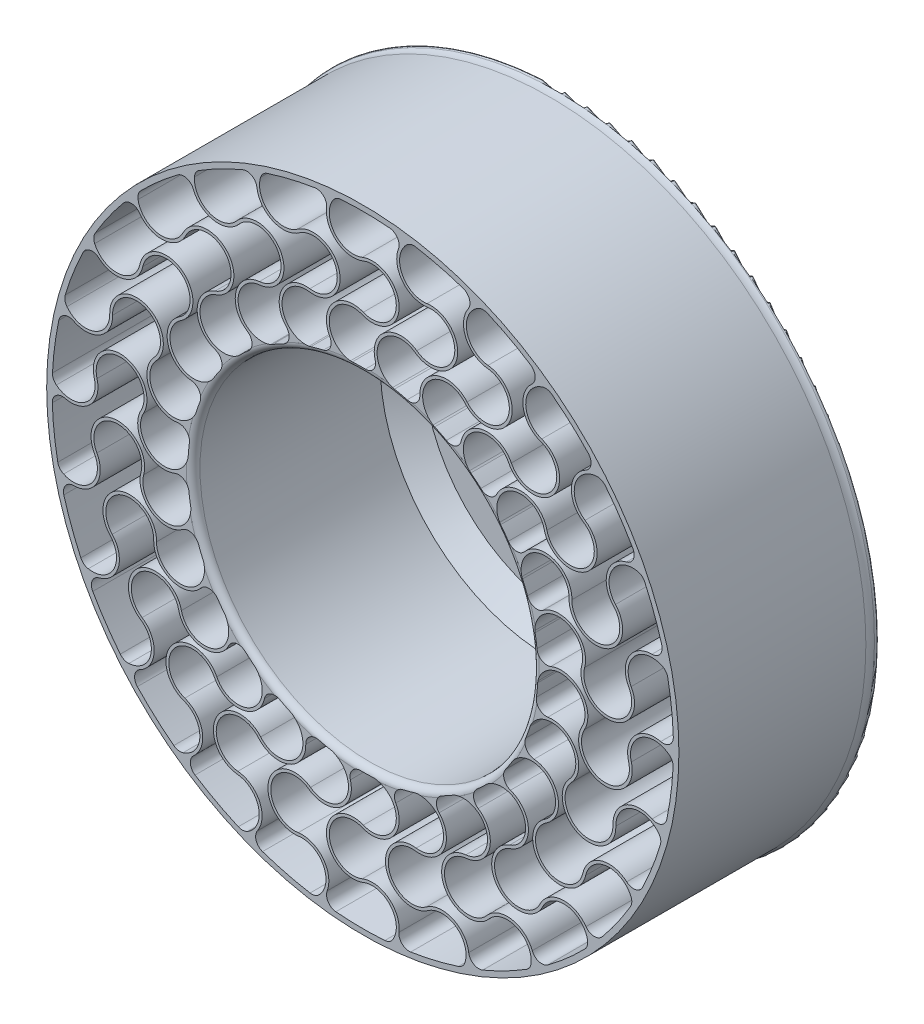
from build123d import *

# Parameters (mm, degrees)
SKETCH1_R                      = 25.75
SKETCH1_R_2                    = 24.95
BOSS_EXTRUDE1_DEPTH            = 27.5
SUPPORTELEMENT_DEPTH           = 27.5
SKETCH3_R                      = 46.5
SKETCH3_R_2                    = 45.7
WHEELRIM_DEPTH                 = 27.5
SUPPORTFILLET_R                = 1.5
CIRPATTERN1_COUNT              = 26
SUPPORTFILLET_OF_CIRPATTERN1_R = 1.5
SKETCH6_R                      = 3.35
BOSS_EXTRUDE2_DEPTH            = 3
SKETCH7_R                      = 1.45
CUT_EXTRUDE1_DEPTH             = 72.773447838


with BuildPart() as part:
    # Sketch1 → Boss-Extrude1 (new body)
    with BuildSketch(Plane.XY):
        Circle(SKETCH1_R)
        Circle(SKETCH1_R_2, mode=Mode.SUBTRACT)
    extrude(amount=BOSS_EXTRUDE1_DEPTH)

    # Sketch2 → SupportElement (add, through all)
    with BuildSketch(Plane.XY.offset(27.5)):
        with BuildLine():
            ThreePointArc((-3.528823527, 46.365907783), (-2.931248774, 46.407518579), (-2.333187577, 46.441428011))
            ThreePointArc((-2.333187577, 46.441428011), (-4.744952593, 41.912596767), (-0.0791435, 39.777848902))
            ThreePointArc((-0.0791435, 39.777848902), (5.350743301, 36.125), (-0.0791435, 32.472151098))
            ThreePointArc((-0.0791435, 32.472151098), (-4.836479603, 30.017910974), (-1.678989563, 25.695203717))
            ThreePointArc((-1.678989563, 25.695203717), (-2.316518866, 25.645589101), (-2.952619591, 25.58015906))
            ThreePointArc((-2.952619591, 25.58015906), (-5.047741148, 30.724265083), (0.0791435, 32.861182235))
            ThreePointArc((0.0791435, 32.861182235), (4.930743301, 36.125), (0.0791435, 39.388817765))
            ThreePointArc((0.0791435, 39.388817765), (-4.910093331, 41.23021634), (-3.528823527, 46.365907783))
        make_face()
    supportelement = extrude(amount=-SUPPORTELEMENT_DEPTH)

    # Sketch3 → WheelRim (add, through all)
    with BuildSketch(Plane.XY.offset(27.5)):
        with Locations(Location((0, 0, 0), (0, 0, 180))):
            Circle(SKETCH3_R)
        Circle(SKETCH3_R_2, mode=Mode.SUBTRACT)
    extrude(amount=-WHEELRIM_DEPTH)

    # SupportFillet
    supportfillet_edges = [part.edges().sort_by_distance(p)[0] for p in [
        (-1.678989563, 25.695203717, 13.75),
        (-2.952619591, 25.58015906, 13.75),
        (-3.898537289, 45.533409789, 13.75),
        (-4.50893023, 45.4770222, 13.75),
    ]]
    fillet(supportfillet_edges, radius=SUPPORTFILLET_R)

    # CirPattern1: SupportElement ×26 about axis
    cirpattern1_axis = Axis((0, 0, 0), (0, 0, 1))
    for i in range(1, CIRPATTERN1_COUNT):
        add(supportelement.rotate(cirpattern1_axis, i * 360 / CIRPATTERN1_COUNT))

    # SupportFillet of CirPattern1
    supportfillet_of_cirpattern1_edges = [part.edges().sort_by_distance(p)[0] for p in [
        (-7.779465924, 24.546739293, 13.75),
        (-8.98855459, 24.130238009, 13.75),
        (-14.682111091, 43.277310613, 13.75),
        (-15.261272689, 43.076484953, 13.75),
        (-13.427828003, 21.971707606, 13.75),
        (-14.502107468, 21.277955235, 13.75),
        (-24.612413965, 38.506091451, 13.75),
        (-25.126685453, 38.172498977, 13.75),
        (-18.295813527, 18.119760136, 13.75),
        (-19.172850573, 17.189075045, 13.75),
        (-33.112332801, 31.497038218, 13.75),
        (-33.53182659, 31.050066112, 13.75),
        (-22.100512871, 13.21475807, 13.75),
        (-22.729337294, 12.101228293, 13.75),
        (-39.687883213, 22.65749161, 13.75),
        (-39.988219848, 22.123116267, 13.75),
        (-24.620810739, 7.541762299, 13.75),
        (-24.964877548, 6.310102138, 13.75),
        (-43.956918112, 12.501173947, 13.75),
        (-44.120643121, 11.910451319, 13.75),
        (-25.71023658, 1.430466716, 13.75),
        (-25.749549864, 0.152255784, 13.75),
        (-45.671336708, 1.618333494, 13.75),
        (-45.688934987, 1.005594232, 13.75),
        (-25.305476923, -4.763962393, 13.75),
        (-25.037751937, -6.014439123, 13.75),
        (-44.731503223, -9.358558619, 13.75),
        (-44.601952024, -9.957704335, 13.75),
        (-23.43005493, -10.681527324, 13.75),
        (-22.870850875, -11.83159669, 13.75),
        (-41.192037363, -19.791565322, 13.75),
        (-40.922865731, -20.342297322, 13.75),
        (-20.192963309, -15.978320713, 13.75),
        (-19.374779094, -16.961144863, 13.75),
        (-35.258640018, -29.074358189, 13.75),
        (-34.865491231, -29.54466993, 13.75),
        (-15.782330059, -20.346512181, 13.75),
        (-14.752715575, -21.104972948, 13.75),
        (-27.276138675, -36.667455038, 13.75),
        (-26.781861111, -37.030013711, 13.75),
        (-10.454485152, -23.532238317, 13.75),
        (-9.273277852, -24.022256719, 13.75),
        (-17.708447298, -42.129572681, 13.75),
        (-17.141766571, -42.363307695, 13.75),
        (-4.519063569, -25.350356299, 13.75),
        (-3.254910927, -25.543454247, 13.75),
        (-7.111605331, -45.143272695, 13.75),
        (-6.505454866, -45.234600219, 13.75),
        (1.678989563, -25.695203717, 13.75),
        (2.952619591, -25.58015906, 13.75),
        (3.898537289, -45.533409789, 13.75),
        (4.50893023, -45.4770222, 13.75),
        (7.779465924, -24.546739293, 13.75),
        (8.98855459, -24.130238009, 13.75),
        (14.682111091, -43.277310613, 13.75),
        (15.261272689, -43.076484953, 13.75),
        (13.427828003, -21.971707606, 13.75),
        (14.502107468, -21.277955235, 13.75),
        (24.612413965, -38.506091451, 13.75),
        (25.126685453, -38.172498977, 13.75),
        (18.295813527, -18.119760136, 13.75),
        (19.172850573, -17.189075045, 13.75),
        (33.112332801, -31.497038218, 13.75),
        (33.53182659, -31.050066112, 13.75),
        (22.100512871, -13.21475807, 13.75),
        (22.729337294, -12.101228293, 13.75),
        (39.687883213, -22.65749161, 13.75),
        (39.988219848, -22.123116267, 13.75),
        (24.620810739, -7.541762299, 13.75),
        (24.964877548, -6.310102138, 13.75),
        (43.956918112, -12.501173947, 13.75),
        (44.120643121, -11.910451319, 13.75),
        (25.71023658, -1.430466716, 13.75),
        (25.749549864, -0.152255784, 13.75),
        (45.671336708, -1.618333494, 13.75),
        (45.688934987, -1.005594232, 13.75),
        (25.305476923, 4.763962393, 13.75),
        (25.037751937, 6.014439123, 13.75),
        (44.731503223, 9.358558619, 13.75),
        (44.601952024, 9.957704335, 13.75),
        (23.43005493, 10.681527324, 13.75),
        (22.870850875, 11.83159669, 13.75),
        (41.192037363, 19.791565322, 13.75),
        (40.922865731, 20.342297322, 13.75),
        (20.192963309, 15.978320713, 13.75),
        (19.374779094, 16.961144863, 13.75),
        (35.258640018, 29.074358189, 13.75),
        (34.865491231, 29.54466993, 13.75),
        (15.782330059, 20.346512181, 13.75),
        (14.752715575, 21.104972948, 13.75),
        (27.276138675, 36.667455038, 13.75),
        (26.781861111, 37.030013711, 13.75),
        (10.454485152, 23.532238317, 13.75),
        (9.273277852, 24.022256719, 13.75),
        (17.708447298, 42.129572681, 13.75),
        (17.141766571, 42.363307695, 13.75),
        (4.519063569, 25.350356299, 13.75),
        (3.254910927, 25.543454247, 13.75),
        (7.111605331, 45.143272695, 13.75),
        (6.505454866, 45.234600219, 13.75),
    ]]
    fillet(supportfillet_of_cirpattern1_edges, radius=SUPPORTFILLET_OF_CIRPATTERN1_R)

    # Sketch5 → Revolve1 (revolve)
    with BuildSketch(Plane(origin=(0, 0, 0), x_dir=(1, 0, 0), z_dir=(0, 1, 0)), mode=Mode.PRIVATE) as revolve1_sk:
        Polygon((-24.95, 0), (-21.75, 3.193225811), (0, 3.193225811), (0, 3.993225811), (-21.75, 3.993225811), (-25.75, 0), align=None)
        with BuildLine():
            Line((-46.5, 0), (-45.7, 0))
            ThreePointArc((-45.7, 0), (-45.795407686, 0.724693326), (-46.075128869, 1.4))
            ThreePointArc((-46.075128869, 1.4), (-46.621539031, 1.546410162), (-46.767949192, 1))
            ThreePointArc((-46.767949192, 1), (-46.568148347, 0.51763809), (-46.5, 0))
        make_face()
    revolve(revolve1_sk.sketch.rotate(Axis((0, 0, 0), (0, 0, -1)), 180), axis=Axis((0, 0, 0), (0, 0, -1)))

    # Sketch6 → Boss-Extrude2 (add)
    with BuildSketch(Plane.XY.offset(-3.193225811)):
        with Locations(Location((-17, 0, 0), (0, 0, 180))):
            Circle(SKETCH6_R)
        with Locations(Location((0, -17, 0), (0, 0, 180))):
            Circle(SKETCH6_R)
        with Locations(Location((17, 0, 0), (0, 0, 180))):
            Circle(SKETCH6_R)
        with Locations(Location((0, 17, 0), (0, 0, 180))):
            Circle(SKETCH6_R)
    extrude(amount=BOSS_EXTRUDE2_DEPTH)

    # Sketch7 → Cut-Extrude1 (cut, through all)
    with BuildSketch(Plane.XY.offset(-0.193225811)):
        with Locations((-17, 0)):
            Circle(SKETCH7_R)
        with Locations((0, 17)):
            Circle(SKETCH7_R)
        with Locations((17, 0)):
            Circle(SKETCH7_R)
        with Locations((0, -17)):
            Circle(SKETCH7_R)
    extrude(amount=-CUT_EXTRUDE1_DEPTH, mode=Mode.SUBTRACT)

    # Fillet2: read off the stored shape, not the designer's step
    # Fillet2 outline → Fillet2 (revolve, cut)
    with BuildSketch(Plane(origin=(-17, 0, 0), x_dir=(1, 0, 0), z_dir=(0, -1, 0))):
        with BuildLine():
            ThreePointArc((2.35, -0.193225811), (3.057106781, -0.48611903), (3.35, -1.193225811))
            Line((3.35, -1.193225811), (3.35, -0.193225811))
            Line((3.35, -0.193225811), (2.35, -0.193225811))
        make_face()
    revolve(axis=Axis((-17, 0, 0), (0, 0, 1)), mode=Mode.SUBTRACT)

    # Fillet2 2 outline → Fillet2 2 (revolve, cut)
    with BuildSketch(Plane.XZ.offset(17)):
        with BuildLine():
            ThreePointArc((2.35, -0.193225811), (3.057106781, -0.48611903), (3.35, -1.193225811))
            Line((3.35, -1.193225811), (3.35, -0.193225811))
            Line((3.35, -0.193225811), (2.35, -0.193225811))
        make_face()
    revolve(axis=Axis((0, -17, 0), (0, 0, 1)), mode=Mode.SUBTRACT)

    # Fillet2 3 outline → Fillet2 3 (revolve, cut)
    with BuildSketch(Plane.XZ.offset(-17)):
        with BuildLine():
            ThreePointArc((2.35, -0.193225811), (3.057106781, -0.48611903), (3.35, -1.193225811))
            Line((3.35, -1.193225811), (3.35, -0.193225811))
            Line((3.35, -0.193225811), (2.35, -0.193225811))
        make_face()
    revolve(axis=Axis((0, 17, 0), (0, 0, 1)), mode=Mode.SUBTRACT)

    # Fillet2 4 outline → Fillet2 4 (revolve, cut)
    with BuildSketch(Plane(origin=(17, 0, 0), x_dir=(1, 0, 0), z_dir=(0, -1, 0))):
        with BuildLine():
            ThreePointArc((2.35, -0.193225811), (3.057106781, -0.48611903), (3.35, -1.193225811))
            Line((3.35, -1.193225811), (3.35, -0.193225811))
            Line((3.35, -0.193225811), (2.35, -0.193225811))
        make_face()
    revolve(axis=Axis((17, 0, 0), (0, 0, 1)), mode=Mode.SUBTRACT)

    # Fillet2 5 outline → Fillet2 5 (revolve, cut)
    with BuildSketch(Plane.XZ):
        with BuildLine():
            ThreePointArc((24.95, 26.5), (25.242893219, 27.207106781), (25.95, 27.5))
            Line((25.95, 27.5), (24.95, 27.5))
            Line((24.95, 27.5), (24.95, 26.5))
        make_face()
    revolve(axis=Axis((0, 0, 0), (0, 0, 1)), mode=Mode.SUBTRACT)


solid = part.part
